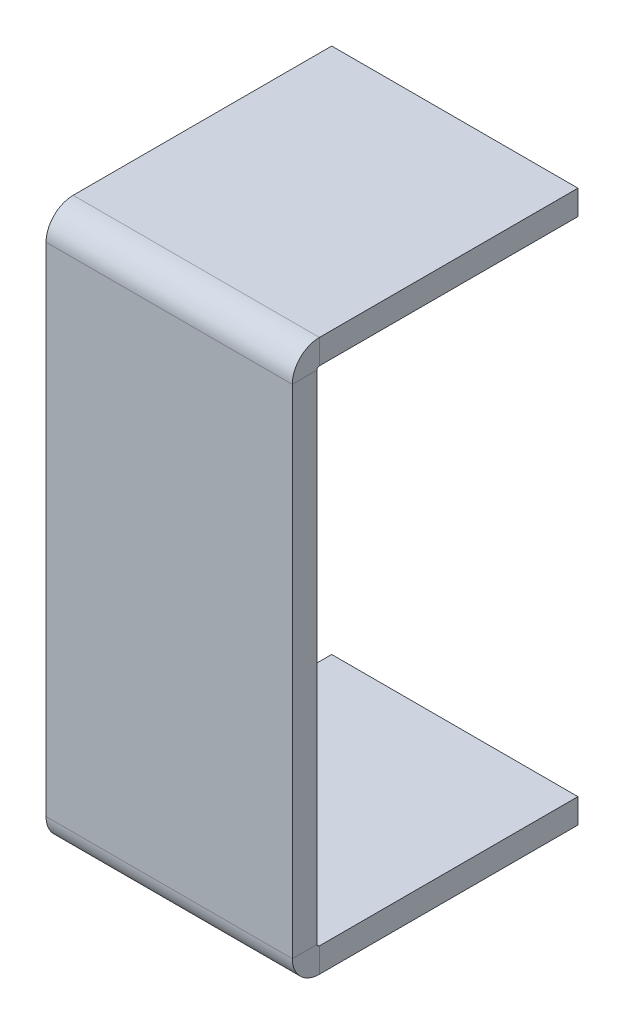
from build123d import *

# Parameters (mm, degrees)
SKETCH_1_W                         = 100
SKETCH_1_H                         = 224
SM_BASE_FLANGE_1_DEPTH             = 10
SM_EDGE_FLANGE_1_STRIP_W           = 42
SM_EDGE_FLANGE_1_STRIP_H           = 10
SM_EDGE_FLANGE_1_STRIP_CUT_DEPTH   = 100
SM_EDGE_FLANGE_1_STRIP_2_W         = 42
SM_EDGE_FLANGE_1_STRIP_2_H         = 10
SM_EDGE_FLANGE_1_STRIP_CUT_2_DEPTH = 100
SM_EDGE_FLANGE_1_DEPTH             = 100
SM_EDGE_FLANGE_1_BEND_DEPTH        = 100


# Sheet-metal steps are written as plain solids
with BuildPart() as part:
    # Sketch 1 → 基体-法兰1 (new body)
    with BuildSketch(Plane.XY):
        Rectangle(SKETCH_1_W, SKETCH_1_H)
    extrude(amount=-SM_BASE_FLANGE_1_DEPTH)

    # 边线-法兰1 strip (across the edge) → 边线-法兰1 strip cut (cut)
    with BuildSketch(Plane(origin=(-50, 112, -10), x_dir=(0, -1, 0), z_dir=(1, 0, 0))):
        with Locations((-10, -5)):
            Rectangle(SM_EDGE_FLANGE_1_STRIP_W, SM_EDGE_FLANGE_1_STRIP_H)
    extrude(amount=SM_EDGE_FLANGE_1_STRIP_CUT_DEPTH, mode=Mode.SUBTRACT)

    # 边线-法兰1 strip 2 (across the edge) → 边线-法兰1 strip cut 2 (cut)
    with BuildSketch(Plane(origin=(50, -112, -10), x_dir=(0, 1, 0), z_dir=(-1, 0, 0))):
        with Locations((-10, -5)):
            Rectangle(SM_EDGE_FLANGE_1_STRIP_2_W, SM_EDGE_FLANGE_1_STRIP_2_H)
    extrude(amount=SM_EDGE_FLANGE_1_STRIP_CUT_2_DEPTH, mode=Mode.SUBTRACT)

    # 边线-法兰1 section (across the edge) → 边线-法兰1 (add)
    with BuildSketch(Plane(origin=(-50, 112, -10), x_dir=(0, -1, 0), z_dir=(1, 0, 0))):
        with BuildLine():
            Line((0, 1), (0, 106))
            Line((0, 106), (10, 106))
            Line((10, 106), (10, 1))
            ThreePointArc((10, 1), (10.292893219, 0.292893219), (11, 0))
            Line((11, 0), (11, -10))
            ThreePointArc((11, -10), (3.221825407, -6.778174593), (0, 1))
        make_face()
    extrude(amount=SM_EDGE_FLANGE_1_DEPTH)

    # 边线-法兰1 section 2 (across the edge) → 边线-法兰1 bend (add)
    with BuildSketch(Plane(origin=(50, -112, -10), x_dir=(0, 1, 0), z_dir=(-1, 0, 0))):
        with BuildLine():
            Line((0, 1), (0, 106))
            Line((0, 106), (10, 106))
            Line((10, 106), (10, 1))
            ThreePointArc((10, 1), (10.292893219, 0.292893219), (11, 0))
            Line((11, 0), (11, -10))
            ThreePointArc((11, -10), (3.221825407, -6.778174593), (0, 1))
        make_face()
    extrude(amount=SM_EDGE_FLANGE_1_BEND_DEPTH)


solid = part.part
